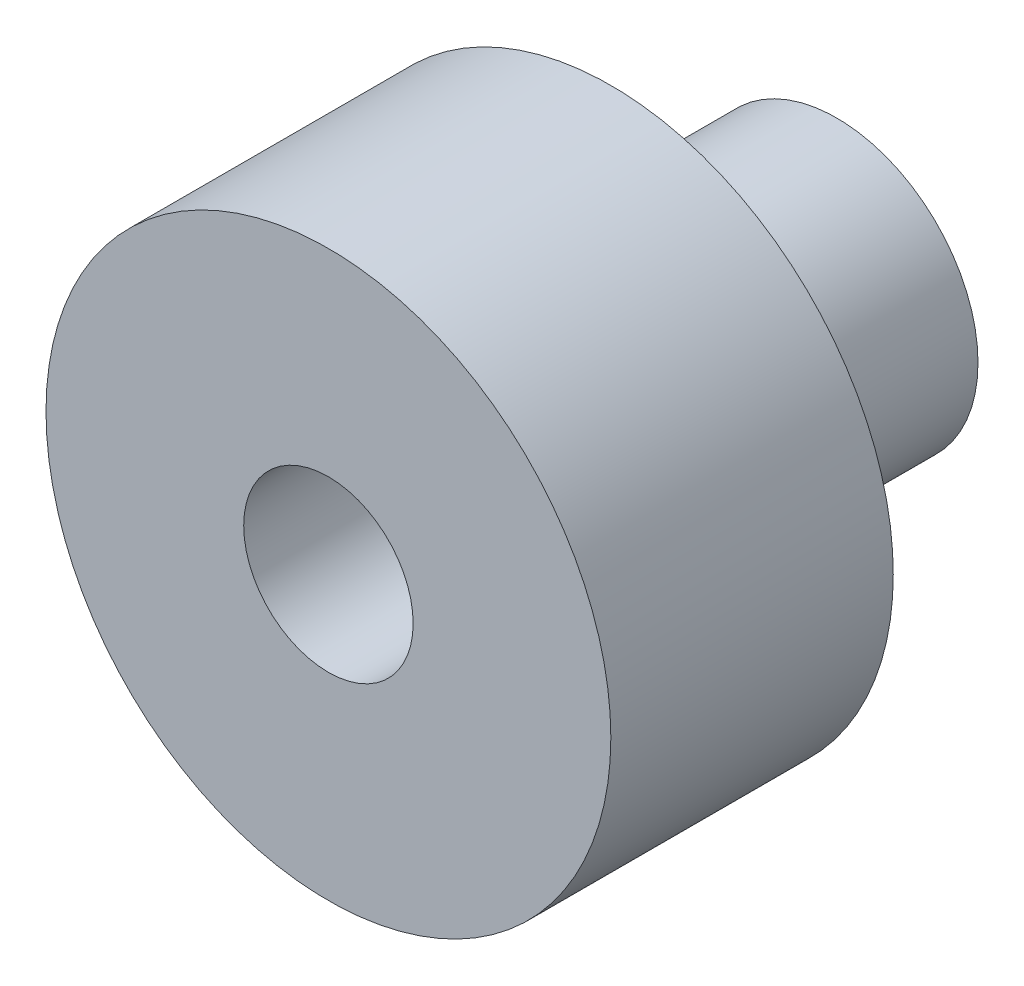
from build123d import *

# Parameters (mm, degrees)
SKETCH1_R           = 10
BOSS_EXTRUDE1_DEPTH = 10
SKETCH3_R           = 5
BOSS_EXTRUDE2_DEPTH = 8
SKETCH4_R           = 3
CUT_EXTRUDE1_DEPTH  = 27
SKETCH5_R           = 1.5
CUT_EXTRUDE2_DEPTH  = 27


with BuildPart() as part:
    # Sketch1 → Boss-Extrude1 (new body)
    with BuildSketch(Plane.XY):
        Circle(SKETCH1_R)
    extrude(amount=BOSS_EXTRUDE1_DEPTH)

    # Sketch3 → Boss-Extrude2 (add)
    with BuildSketch(Plane(origin=(0, 0, 0), x_dir=(-1, 0, 0), z_dir=(0, 0, -1))):
        Circle(SKETCH3_R)
    extrude(amount=BOSS_EXTRUDE2_DEPTH)

    # Sketch4 → Cut-Extrude1 (cut)
    with BuildSketch(Plane(origin=(0, 0, -8), x_dir=(-1, 0, 0), z_dir=(0, 0, -1))):
        Circle(SKETCH4_R)
    extrude(amount=-CUT_EXTRUDE1_DEPTH, mode=Mode.SUBTRACT)

    # Sketch5 → Cut-Extrude2 (cut)
    with BuildSketch(Plane(origin=(0, 0, 0), x_dir=(1, 0, 0), z_dir=(0, 1, 0))):
        with Locations((0, 5)):
            Circle(SKETCH5_R)
    extrude(amount=-CUT_EXTRUDE2_DEPTH, mode=Mode.SUBTRACT)


solid = part.part
